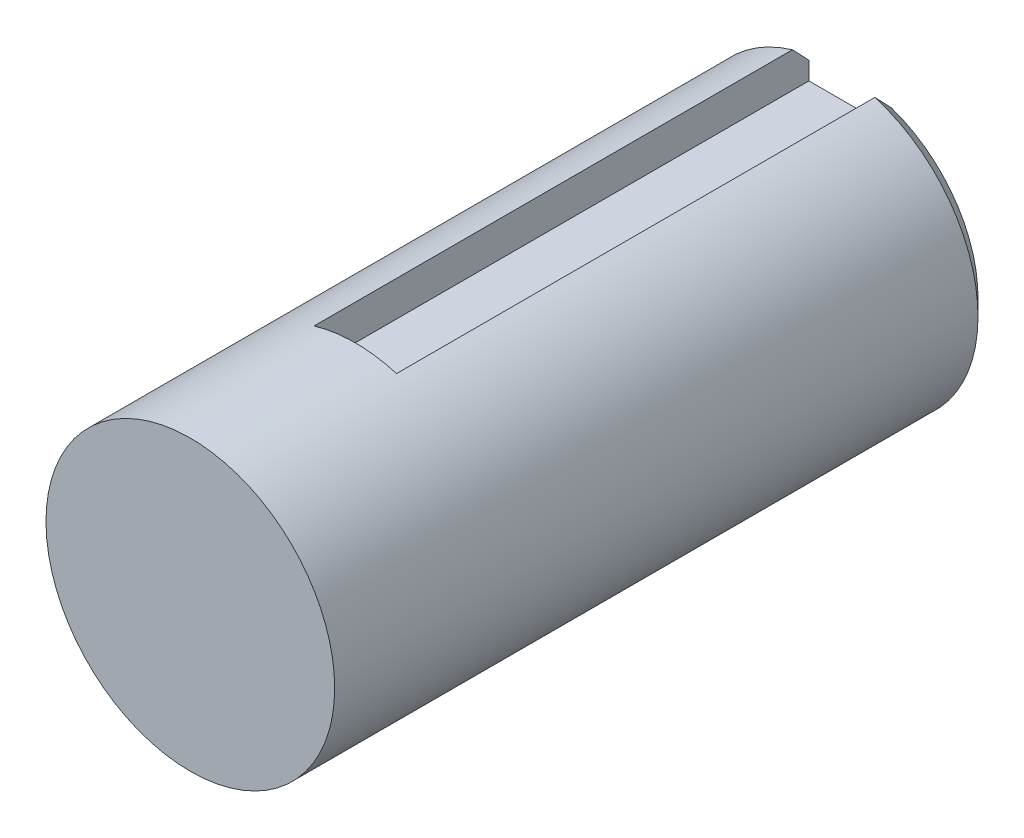
from build123d import *

# Parameters (mm, degrees)
BOSS_EXTRUDE1_DEPTH = 80
BOSS_EXTRUDE2_START = -20
BOSS_EXTRUDE2_DEPTH = 20
CHAMFER1_SIZE       = 2


with BuildPart() as part:
    # Sketch1 → Boss-Extrude1 (new body)
    with BuildSketch(Plane.XY):
        with BuildLine():
            Line((-5, 12.5), (5, 12.5))
            Line((5, 12.5), (5, 16.770509831))
            ThreePointArc((5, 16.770509831), (0, -17.5), (-5, 16.770509831))
            Line((-5, 16.770509831), (-5, 12.5))
        make_face()
    extrude(amount=BOSS_EXTRUDE1_DEPTH)

    # Sketch2 → Boss-Extrude2 (add)
    with BuildSketch(Plane.XY.offset(80).offset(BOSS_EXTRUDE2_START)):
        with BuildLine():
            Line((5, 12.5), (5, 16.770509831))
            ThreePointArc((5, 16.770509831), (0, 17.5), (-5, 16.770509831))
            Line((-5, 16.770509831), (-5, 12.5))
            Line((-5, 12.5), (5, 12.5))
        make_face()
    extrude(amount=BOSS_EXTRUDE2_DEPTH)

    # Chamfer1
    chamfer1_edges = [part.edges().sort_by_distance(p)[0] for p in [
        (0, -17.5, 0),
    ]]
    chamfer(chamfer1_edges, length=CHAMFER1_SIZE)


solid = part.part
